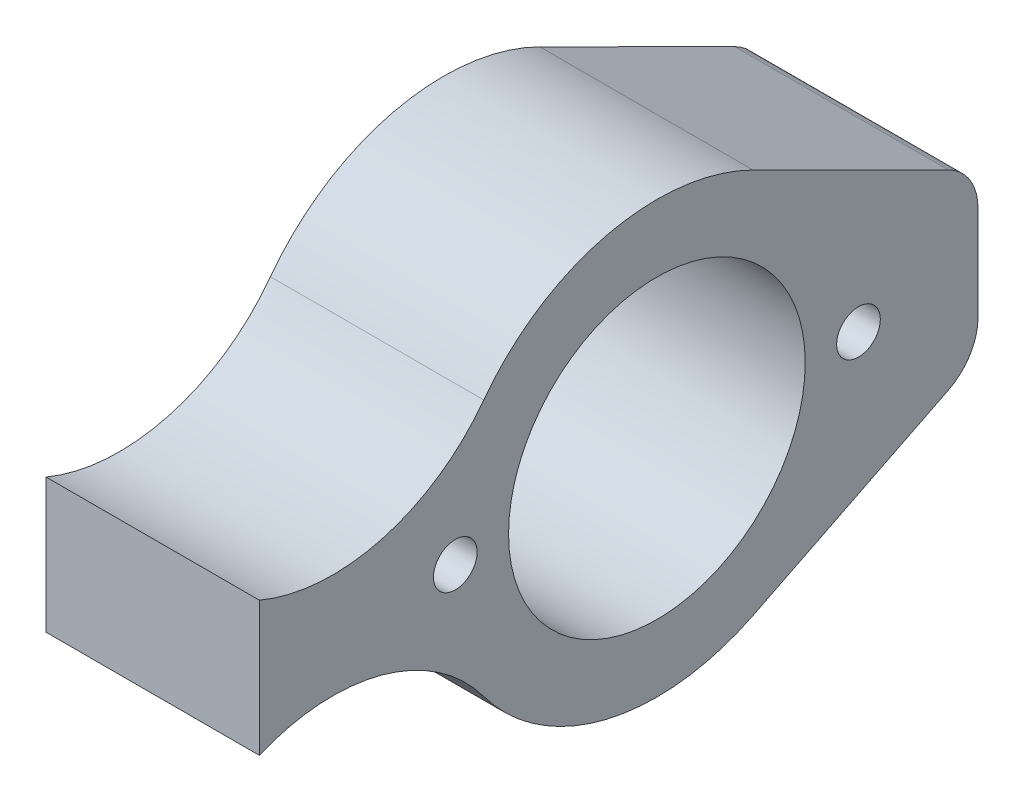
from build123d import *

# Parameters (mm, degrees)
SKETCH1_R           = 11.0375
SKETCH1_R_2         = 1.625
BOSS_EXTRUDE1_DEPTH = 7.9375


with BuildPart() as part:
    # Sketch1 → Boss-Extrude1 (new, symmetric)
    with BuildSketch(Plane(origin=(0, 0, 0), x_dir=(0, 0, -1), z_dir=(1, 0, 0))):
        with BuildLine():
            Line((-29.580398915, 5), (-29.580398915, -5))
            ThreePointArc((-29.580398915, -5), (-20.442763733, -4.386976524), (-12.881257695, -9.553774461))
            ThreePointArc((-12.881257695, -9.553774461), (-3.732382193, -15.597138501), (7.161128242, -14.349900646))
            Line((7.161128242, -14.349900646), (21.679258623, -7.104819579))
            ThreePointArc((21.679258623, -7.104819579), (23.294955164, -5.629968678), (23.893162725, -3.525732902))
            Line((23.893162725, -3.525732902), (23.893162725, 3.525732902))
            ThreePointArc((23.893162725, 3.525732902), (23.294955164, 5.629968678), (21.679258623, 7.104819579))
            Line((21.679258623, 7.104819579), (7.161128242, 14.349900646))
            ThreePointArc((7.161128242, 14.349900646), (-3.732382193, 15.597138501), (-12.881257695, 9.553774461))
            ThreePointArc((-12.881257695, 9.553774461), (-20.442763733, 4.386976524), (-29.580398915, 5))
        make_face()
        Circle(SKETCH1_R, mode=Mode.SUBTRACT)
        with Locations((-15, 0)):
            Circle(SKETCH1_R_2, mode=Mode.SUBTRACT)
        with Locations((15, 0)):
            Circle(SKETCH1_R_2, mode=Mode.SUBTRACT)
    extrude(amount=BOSS_EXTRUDE1_DEPTH, both=True)


solid = part.part
